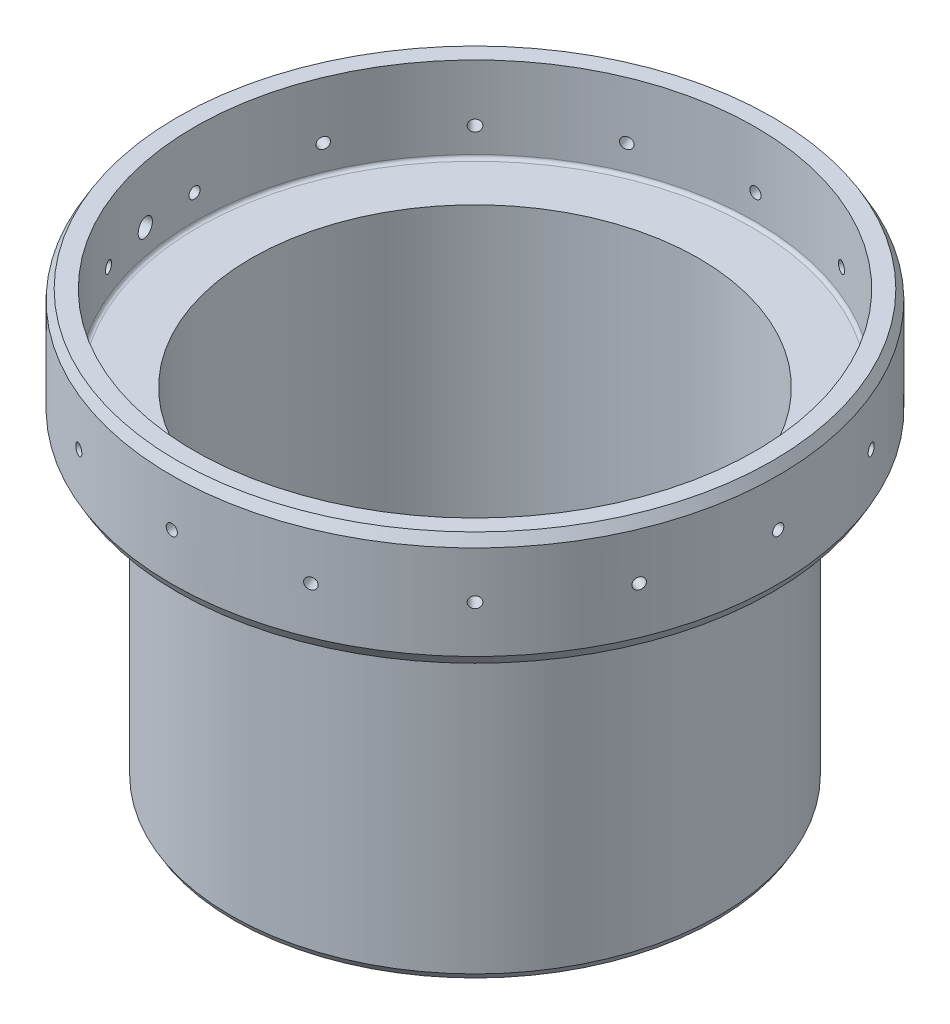
from build123d import *
from OCP.BRepFilletAPI import BRepFilletAPI_MakeChamfer

# Parameters (mm, degrees)
CIRPATTERN1_COUNT              = 16
TAP_DRILL_FOR_10_32_TAP1_D     = 4.0386
TAP_DRILL_FOR_10_32_TAP1_DEPTH = 10.16
TAP_DRILL_FOR_10_32_TAP1_TIP   = 1.213317848
CIRPATTERN2_COUNT              = 16
CHAMFER2_SIZE                  = 1.27
CHAMFER2_SIZE2                 = 2.199704526
CHAMFER4_SIZE                  = 0.762
CHAMFER4_SIZE2                 = 1.319822715
CHAMFER5_SIZE                  = 0.762
CHAMFER5_SIZE2                 = 1.319822715
FILLET1_R                      = 0.762


with BuildPart() as part:
    # Sketch1 → Revolve6 (revolve)
    with BuildSketch(Plane.XY):
        Polygon((-62.6618, 0), (-67.7418, 0), (-67.7418, -25.4), (-54.55285, -25.4), (-54.55285, -95.25), (-49.98085, -95.25), (-49.98085, -19.05), (-62.6618, -19.05), align=None)
    revolve(axis=Axis((0, 0, 0), (0, 1, 0)))

    # Sketch4 → Tap Drill for M3x0.5 Tap1 (revolve, cut)
    with BuildSketch(Plane(origin=(-67.7418, -12.7, 0), x_dir=(0, 0, 1), z_dir=(0, 1, 0))):
        Polygon((0, 0), (0, 10.911075774), (1.25, 10.16), (1.25, 0), align=None)
    tap_drill_for_m3x0_5_tap1 = revolve(axis=Axis((-74.0918, -12.7, 0), (1, 0, 0)), mode=Mode.SUBTRACT)

    # CirPattern1: Tap Drill for M3x0.5 Tap1 ×16 about axis
    cirpattern1_axis = Axis((0, 0, 0), (0, -1, 0))
    for i in range(1, CIRPATTERN1_COUNT):
        add(tap_drill_for_m3x0_5_tap1.rotate(cirpattern1_axis, i * 360 / CIRPATTERN1_COUNT), mode=Mode.SUBTRACT)

    # Tap Drill for #10-32 Tap1
    with Locations(Plane(origin=(-66.440160308, 0, 13.215769576), x_dir=(0.19509032201612886, 0, 0.9807852804032304), z_dir=(-0.9807852804032304, 0, 0.19509032201612886))):
        with Locations((0, -12.7)):
            Hole(TAP_DRILL_FOR_10_32_TAP1_D / 2, depth=TAP_DRILL_FOR_10_32_TAP1_DEPTH)
            with Locations((0, 0, -(TAP_DRILL_FOR_10_32_TAP1_DEPTH + TAP_DRILL_FOR_10_32_TAP1_TIP / 2))):  # 118° drill point
                Cone(0, TAP_DRILL_FOR_10_32_TAP1_D / 2, TAP_DRILL_FOR_10_32_TAP1_TIP, mode=Mode.SUBTRACT)

    # Sketch10 → Tap Drill for #4-40 Tap1 (revolve, cut)
    with BuildSketch(Plane(origin=(52.26685, -95.25, 0), x_dir=(0, 0, -1), z_dir=(1, 0, 0))):
        Polygon((0, 0), (0, 18.459152758), (1.1303, 17.78), (1.1303, 0), align=None)
    tap_drill_for_4_40_tap1 = revolve(axis=Axis((52.26685, -101.6, 0), (0, 1, 0)), mode=Mode.SUBTRACT)

    # CirPattern2: Tap Drill for #4-40 Tap1 ×16 about axis
    cirpattern2_axis = Axis((0, 0, 0), (0, -1, 0))
    for i in range(1, CIRPATTERN2_COUNT):
        add(tap_drill_for_4_40_tap1.rotate(cirpattern2_axis, i * 360 / CIRPATTERN2_COUNT), mode=Mode.SUBTRACT)

    # Chamfer2: one chamfer whose edges measure the first distance from different faces: ONE call of the kernel's chamfer builder (chamfer() names one face for all edges)
    chamfer2_edges_1 = [part.edges().sort_by_distance(p)[0] for p in [
        (67.7418, -25.4, 0),
    ]]
    chamfer2_side_1 = [part.faces().sort_by_distance(p)[0] for p in [
        (65.825772554, -25.4, 0),
    ]]
    chamfer2_edges_2 = [part.edges().sort_by_distance(p)[0] for p in [
        (67.7418, 0, 0),
    ]]
    chamfer2_side_2 = [part.faces().sort_by_distance(p)[0] for p in [
        (64.577827446, 0, 0),
    ]]
    chamfer2 = BRepFilletAPI_MakeChamfer(part.part.solid().wrapped)
    for e in chamfer2_edges_1:
        chamfer2.Add(CHAMFER2_SIZE, CHAMFER2_SIZE2, e.wrapped, chamfer2_side_1[0].wrapped)  # the first distance lies on this face
    for e in chamfer2_edges_2:
        chamfer2.Add(CHAMFER2_SIZE, CHAMFER2_SIZE2, e.wrapped, chamfer2_side_2[0].wrapped)  # the first distance lies on this face
    add(Compound.cast(chamfer2.Shape()), mode=Mode.REPLACE)

    # Chamfer4
    chamfer4_edges = [part.edges().sort_by_distance(p)[0] for p in [
        (54.55285, -95.25, 0),
    ]]
    chamfer4_side = [part.faces().sort_by_distance(p)[0] for p in [
        (54.398551239, -95.25, 0),
    ]]
    chamfer(chamfer4_edges, length=CHAMFER4_SIZE, length2=CHAMFER4_SIZE2, reference=chamfer4_side[0])

    # Chamfer5
    chamfer5_edges = [part.edges().sort_by_distance(p)[0] for p in [
        (49.98085, -95.25, 0),
    ]]
    chamfer5_side = [part.faces().sort_by_distance(p)[0] for p in [
        (53.638706501, -95.25, 0),
    ]]
    chamfer(chamfer5_edges, length=CHAMFER5_SIZE, length2=CHAMFER5_SIZE2, reference=chamfer5_side[0])

    # Fillet1
    fillet1_edges = [part.edges().sort_by_distance(p)[0] for p in [
        (54.55285, -25.4, 0),
        (62.6618, -19.05, 0),
    ]]
    fillet(fillet1_edges, radius=FILLET1_R)


solid = part.part
